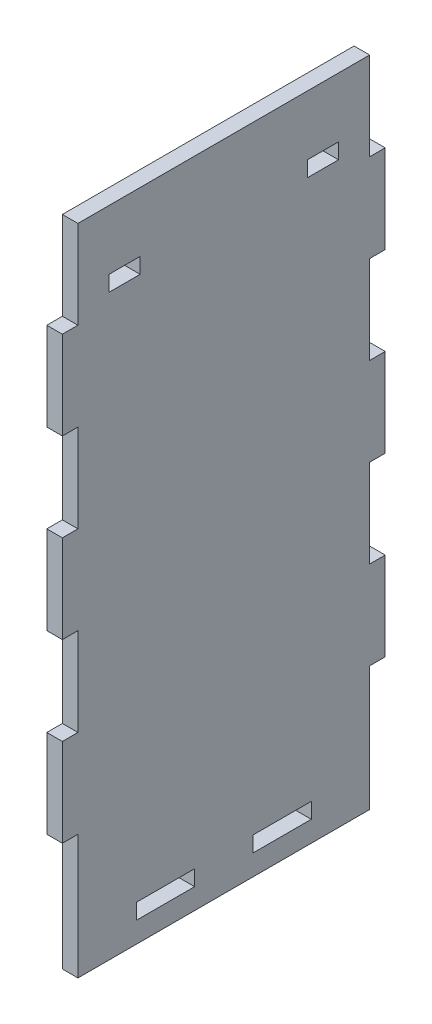
from build123d import *

# Parameters (mm, degrees)
SKETCH1_W           = 112.5
SKETCH1_H           = 238
BOSS_EXTRUDE1_DEPTH = 6
SKETCH4_W           = 6
SKETCH4_H           = 22.5
BOSS_EXTRUDE2_DEPTH = 6
SKETCH5_W           = 6
SKETCH5_H           = 34
BOSS_EXTRUDE3_DEPTH = 6
SKETCH6_W           = 12
SKETCH6_H           = 6
CUT_EXTRUDE1_DEPTH  = 800
SKETCH7_W           = 6
SKETCH7_H           = 112.5
BOSS_EXTRUDE4_DEPTH = 8


with BuildPart() as part:
    # Sketch1 → Boss-Extrude1 (new body)
    with BuildSketch(Plane(origin=(0, 0, 0), x_dir=(0, 0, -1), z_dir=(1, 0, 0))):
        Rectangle(SKETCH1_W, SKETCH1_H)
    extrude(amount=BOSS_EXTRUDE1_DEPTH)

    # Sketch4 → Boss-Extrude2 (add)
    with BuildSketch(Plane.XZ.offset(119)):
        with Locations((3, -45)):
            Rectangle(SKETCH4_W, SKETCH4_H)
        with Locations((3, 0)):
            Rectangle(SKETCH4_W, SKETCH4_H)
        with Locations((3, 45)):
            Rectangle(SKETCH4_W, SKETCH4_H)
    extrude(amount=BOSS_EXTRUDE2_DEPTH)

    # Sketch5 → Boss-Extrude3 (add)
    with BuildSketch(Plane(origin=(0, 0, -56.25), x_dir=(-1, 0, 0), z_dir=(0, 0, -1))):
        with Locations((-3, -68)):
            Rectangle(SKETCH5_W, SKETCH5_H)
        with Locations((-3, 0)):
            Rectangle(SKETCH5_W, SKETCH5_H)
        with Locations((-3, 68)):
            Rectangle(SKETCH5_W, SKETCH5_H)
    boss_extrude3 = extrude(amount=BOSS_EXTRUDE3_DEPTH)

    # Mirror1: Boss-Extrude3 across plane
    add(boss_extrude3.mirror(Plane.XY))

    # Sketch6 → Cut-Extrude1 (cut)
    with BuildSketch(Plane(origin=(6, 0, 0), x_dir=(0, 0, -1), z_dir=(1, 0, 0))):
        with Locations((38.25, 93)):
            Rectangle(SKETCH6_W, SKETCH6_H)
        with Locations((-38.25, 93)):
            Rectangle(SKETCH6_W, SKETCH6_H)
    extrude(amount=-CUT_EXTRUDE1_DEPTH, mode=Mode.SUBTRACT)

    # Sketch7 → Boss-Extrude4 (add)
    with BuildSketch(Plane.XZ.offset(125)):
        with Locations((3, 0)):
            Rectangle(SKETCH7_W, SKETCH7_H)
    extrude(amount=BOSS_EXTRUDE4_DEPTH)


solid = part.part
